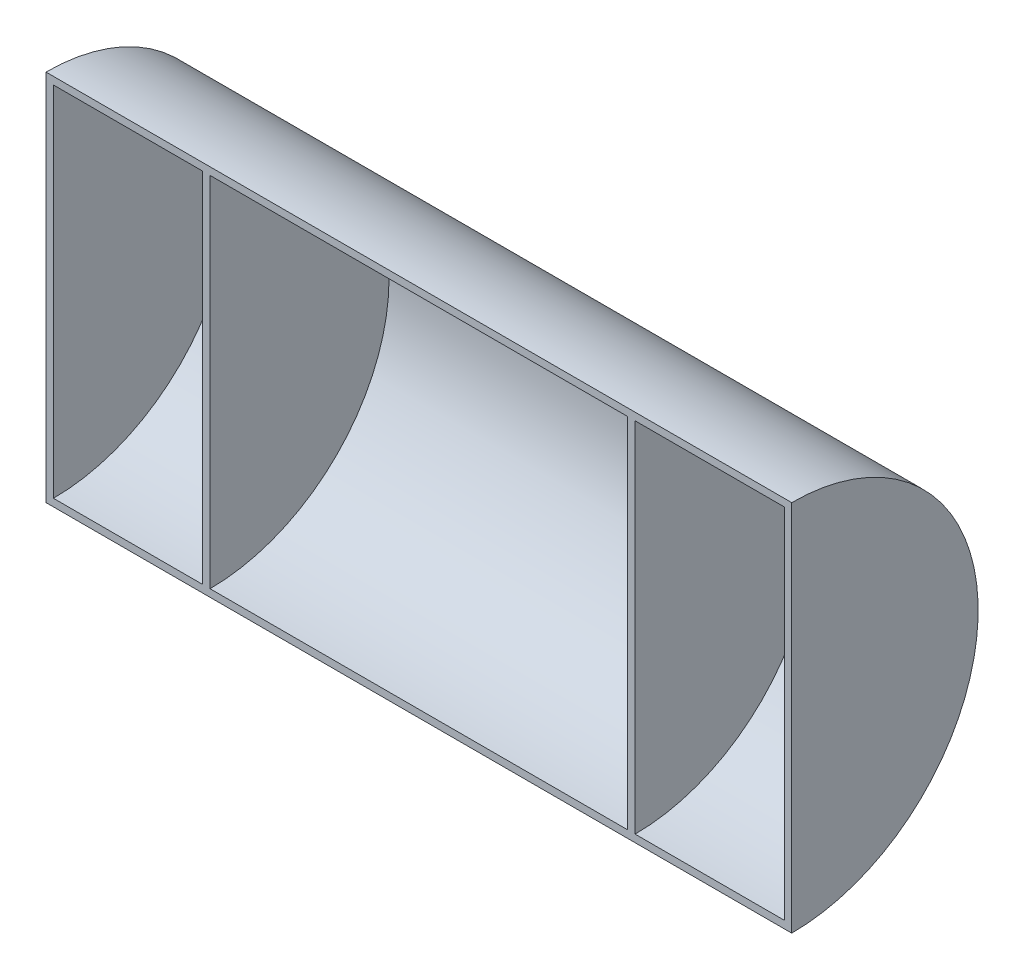
from build123d import *

# Parameters (mm, degrees)
PROFILE_EXTRUDE_DEPTH      = 200
PROFILE_SHELL_T            = -2
SUPPORT_EXTRUDE_REACH      = 214.132
SUPPORT_EXTRUDE_END_RADIUS = 48
SUPPORT_SKETCH_W           = 2
SUPPORT_SKETCH_H           = 96


with BuildPart() as part:
    # Profile Sketch → Profile Extrude (new body)
    with BuildSketch(Plane(origin=(0, 0, 0), x_dir=(0, 0, -1), z_dir=(1, 0, 0))):
        with BuildLine():
            Line((0, 50), (0, -50))
            ThreePointArc((0, -50), (50, 0), (0, 50))
        make_face()
    extrude(amount=-PROFILE_EXTRUDE_DEPTH)

    # Profile Shell
    profile_shell_openings = [part.faces().sort_by_distance(p)[0] for p in [
        (-100, 0, 0),
    ]]
    offset(amount=PROFILE_SHELL_T, openings=profile_shell_openings)

    # Support Extrude: up to this cylinder (the profile starts inside it)
    support_extrude_end = Plane(origin=(-100, 0, 0), z_dir=(1, 0, 0)) * Cylinder(SUPPORT_EXTRUDE_END_RADIUS, 639.264, mode=Mode.PRIVATE)
    # Support Sketch → Support Extrude (add, up to the surface)
    with BuildSketch(Plane.XY, mode=Mode.PRIVATE) as support_extrude_sk1:
        with Locations((-157, 0)):
            Rectangle(SUPPORT_SKETCH_W, SUPPORT_SKETCH_H)
    support_extrude_tool1 = extrude(support_extrude_sk1.sketch, amount=-SUPPORT_EXTRUDE_REACH, mode=Mode.PRIVATE) & support_extrude_end
    add(support_extrude_tool1.solids().sort_by_distance((-157, 0, 0))[0])
    # Support Sketch → Support Extrude (add, up to the surface)
    with BuildSketch(Plane.XY, mode=Mode.PRIVATE) as support_extrude_sk2:
        with Locations((-43, 0)):
            Rectangle(SUPPORT_SKETCH_W, SUPPORT_SKETCH_H)
    support_extrude_tool2 = extrude(support_extrude_sk2.sketch, amount=-SUPPORT_EXTRUDE_REACH, mode=Mode.PRIVATE) & support_extrude_end
    add(support_extrude_tool2.solids().sort_by_distance((-43, 0, 0))[0])


solid = part.part
